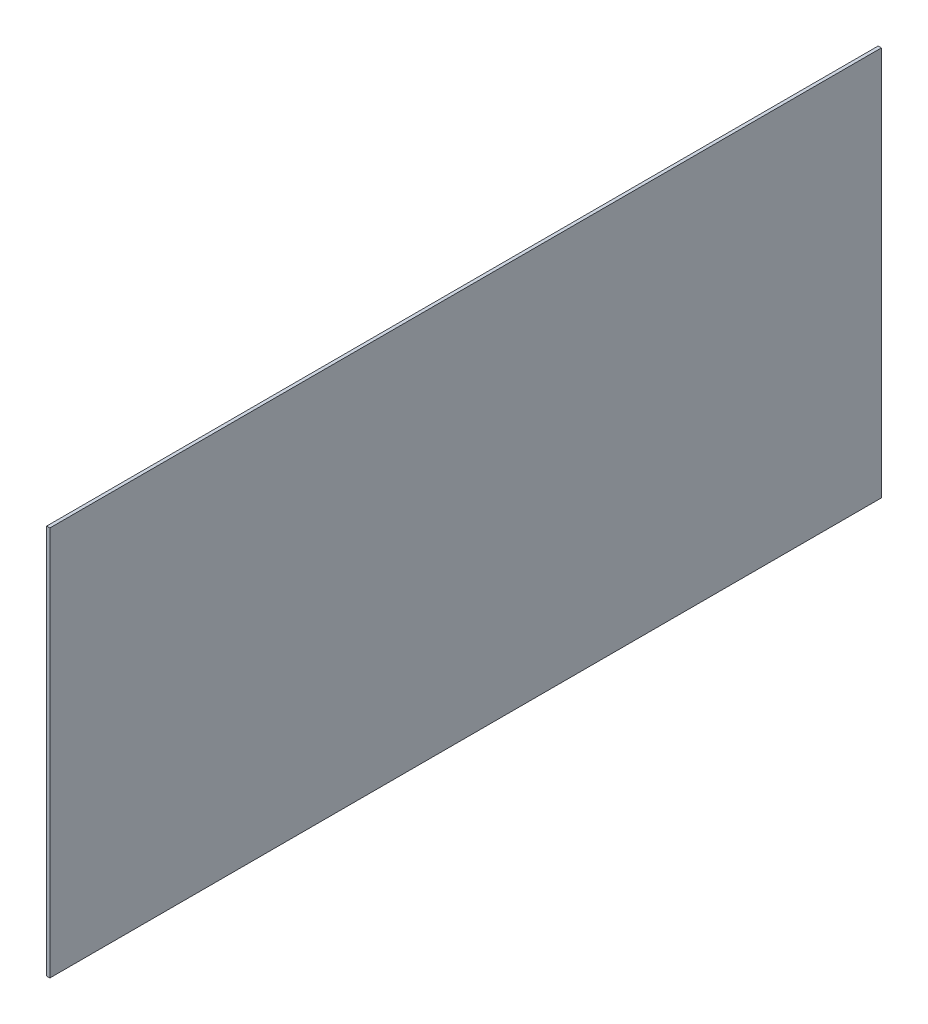
from build123d import *

# Parameters (mm, degrees)
SKETCH1_W           = 6.35
SKETCH1_H           = 1625.6
BOSS_EXTRUDE1_DEPTH = 762


with BuildPart() as part:
    # Sketch1 → Boss-Extrude1 (new body)
    with BuildSketch(Plane(origin=(0, 0, 0), x_dir=(1, 0, 0), z_dir=(0, 1, 0))):
        with Locations((3.175, -812.8)):
            Rectangle(SKETCH1_W, SKETCH1_H)
    extrude(amount=BOSS_EXTRUDE1_DEPTH)


solid = part.part
